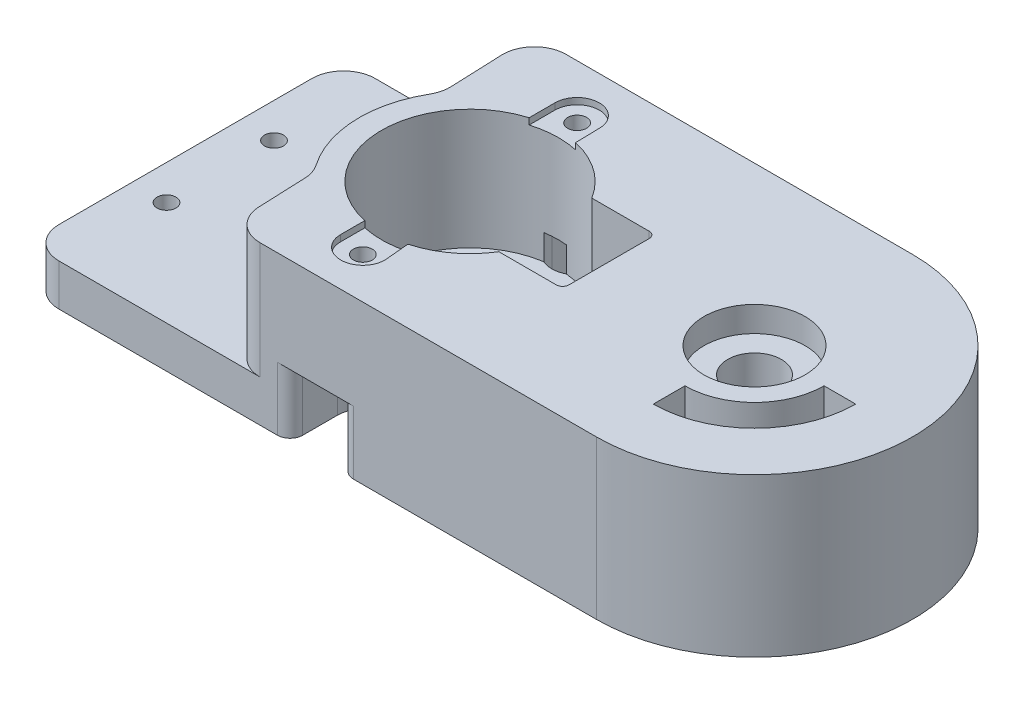
from build123d import *

# Parameters (mm, degrees)
BOSS_EXTRUDE1_DEPTH = 25
SKETCH2_R           = 14
CUT_EXTRUDE1_DEPTH  = 19
CUT_EXTRUDE2_DEPTH  = 1
SKETCH4_R           = 1.5
CUT_EXTRUDE3_DEPTH  = 79.108898341
SKETCH5_R           = 1.5
CUT_EXTRUDE4_DEPTH  = 79.108898341
CUT_EXTRUDE7_DEPTH  = 19
FILLET1_R           = 1
CUT_EXTRUDE8_DEPTH  = 18.4
FILLET2_R           = 5
SKETCH8_R           = 1.5
CUT_EXTRUDE9_DEPTH  = 77.573885888
SKETCH9_R           = 2.5
CUT_EXTRUDE10_DEPTH = 2
FILLET3_R           = 2
CUT_EXTRUDE11_DEPTH = 10
FILLET4_R           = 2
SKETCH11_R          = 8
CUT_EXTRUDE12_DEPTH = 4
SKETCH12_R          = 4.25
CUT_EXTRUDE13_DEPTH = 78.239886096
CUT_EXTRUDE16_DEPTH = 25


with BuildPart() as part:
    # Sketch1 → Boss-Extrude1 (new body)
    with BuildSketch(Plane(origin=(0, 0, 0), x_dir=(1, 0, 0), z_dir=(0, 1, 0))):
        with BuildLine():
            Line((-45, 25), (45, 25))
            ThreePointArc((45, 25), (70, 0), (45, -25))
            Line((45, -25), (-45, -25))
            Line((-45, -25), (-45, 25))
        make_face()
    extrude(amount=BOSS_EXTRUDE1_DEPTH)

    # Sketch2 → Cut-Extrude1 (cut)
    with BuildSketch(Plane(origin=(0, 25, 0), x_dir=(1, 0, 0), z_dir=(0, 1, 0))):
        with Locations(Location((0, 0, 0), (0, 0, 270))):
            Circle(SKETCH2_R)
    extrude(amount=-CUT_EXTRUDE1_DEPTH, mode=Mode.SUBTRACT)

    # Sketch3 → Cut-Extrude2 (cut)
    with BuildSketch(Plane(origin=(0, 25, 0), x_dir=(1, 0, 0), z_dir=(0, 1, 0))):
        with BuildLine():
            ThreePointArc((2.953843371, 17.491475436), (-0.546156629, 20.991475436), (-4.046156629, 17.491475436))
            Line((-4.046156629, 17.491475436), (-4.046156629, 13.402560074))
            ThreePointArc((-4.046156629, 13.402560074), (-0.522473122, 13.990247383), (3.035229041, 13.667018134))
            Line((3.035229041, 13.667018134), (2.953843371, 17.491475436))
        make_face()
        with BuildLine():
            Line((-2.953843371, -13.684838667), (-2.953843371, -17.491475436))
            ThreePointArc((-2.953843371, -17.491475436), (0.546156629, -20.991475436), (4.046156629, -17.491475436))
            Line((4.046156629, -17.491475436), (3.686093385, -13.506025158))
            ThreePointArc((3.686093385, -13.506025158), (0.376883388, -13.994926185), (-2.953843371, -13.684838667))
        make_face()
    extrude(amount=-CUT_EXTRUDE2_DEPTH, mode=Mode.SUBTRACT)

    # Sketch4 → Cut-Extrude3 (cut, through all)
    with BuildSketch(Plane(origin=(0, 24, 0), x_dir=(1, 0, 0), z_dir=(0, 1, 0))):
        with Locations(Location((-0.546156629, 17.491475436, 0), (0, 0, 270))):
            Circle(SKETCH4_R)
    extrude(amount=-CUT_EXTRUDE3_DEPTH, mode=Mode.SUBTRACT)

    # Sketch5 → Cut-Extrude4 (cut, through all)
    with BuildSketch(Plane(origin=(0, 24, 0), x_dir=(1, 0, 0), z_dir=(0, 1, 0))):
        with Locations(Location((0.546156629, -17.491475436, 0), (0, 0, 270))):
            Circle(SKETCH5_R)
    extrude(amount=-CUT_EXTRUDE4_DEPTH, mode=Mode.SUBTRACT)

    # Sketch6 → Cut-Extrude7 (cut)
    with BuildSketch(Plane(origin=(0, 25, 0), x_dir=(1, 0, 0), z_dir=(0, 1, 0))):
        with BuildLine():
            Line((22, 7.35), (22, -7.35))
            Line((22, -7.35), (11.915431171, -7.35))
            Line((11.915431171, -7.35), (11.920287143, -7.342121929))
            ThreePointArc((11.920287143, -7.342121929), (13.999999235, 0.004627215), (11.915431171, 7.35))
            Line((11.915431171, 7.35), (22, 7.35))
        make_face()
    extrude(amount=-CUT_EXTRUDE7_DEPTH, mode=Mode.SUBTRACT)

    # Fillet1
    fillet1_edges = [part.edges().sort_by_distance(p)[0] for p in [
        (22, 15.5, 7.35),
        (22, 15.5, -7.35),
    ]]
    fillet(fillet1_edges, radius=FILLET1_R)

    # Sketch7 → Cut-Extrude8 (cut)
    with BuildSketch(Plane(origin=(0, 25, 0), x_dir=(1, 0, 0), z_dir=(0, 1, 0))):
        with BuildLine():
            Line((-14.411704874, 9.927374408), (-15.019516237, 25))
            Line((-15.019516237, 25), (-45, 25))
            Line((-45, 25), (-45, -25))
            Line((-45, -25), (-13.003240573, -25))
            Line((-13.003240573, -25), (-13.565556796, -11.055571845))
            ThreePointArc((-13.565556796, -11.055571845), (-17.485788544, -0.705123398), (-14.411704874, 9.927374408))
        make_face()
    extrude(amount=-CUT_EXTRUDE8_DEPTH, mode=Mode.SUBTRACT)

    # Fillet2
    fillet2_edges = [part.edges().sort_by_distance(p)[0] for p in [
        (-45, 3.3, 25),
        (-45, 3.3, -25),
        (-14.411704874, 15.8, -9.927374408),
        (-13.565556796, 15.8, 11.055571845),
        (-13.003240573, 15.8, 25),
        (-15.019516237, 15.8, -25),
    ]]
    fillet(fillet2_edges, radius=FILLET2_R)

    # Sketch8 → Cut-Extrude9 (cut, through all)
    with BuildSketch(Plane(origin=(0, 6.6, 0), x_dir=(1, 0, 0), z_dir=(0, 1, 0))):
        with Locations(Location((-39.5, 8.5, 0), (0, 0, 270))):
            Circle(SKETCH8_R)
        with Locations(Location((-39.5, -8.5, 0), (0, 0, 270))):
            Circle(SKETCH8_R)
    extrude(amount=-CUT_EXTRUDE9_DEPTH, mode=Mode.SUBTRACT)

    # Sketch9 → Cut-Extrude10 (cut)
    with BuildSketch(Plane.XZ):
        with Locations(Location((-39.5, 8.5, 0), (0, 0, 270))):
            Circle(SKETCH9_R)
        with Locations(Location((-39.5, -8.5, 0), (0, 0, 270))):
            Circle(SKETCH9_R)
    extrude(amount=-CUT_EXTRUDE10_DEPTH, mode=Mode.SUBTRACT)

    # Fillet3
    fillet3_edges = [part.edges().sort_by_distance(p)[0] for p in [
        (-39.5, 0, 11),
        (-39.5, 0, -6),
    ]]
    fillet(fillet3_edges, radius=FILLET3_R - 0.0001)  # a hair under: the kernel refuses the full size

    # Sketch10 → Cut-Extrude11 (cut)
    with BuildSketch(Plane.XZ):
        with BuildLine():
            Line((-3.453843371, 17.491475436), (-3.453843371, 25))
            Line((-3.453843371, 25), (4.546156629, 25))
            Line((4.546156629, 25), (4.546156629, 17.491475436))
            ThreePointArc((4.546156629, 17.491475436), (0.546156629, 13.491475436), (-3.453843371, 17.491475436))
        make_face()
        with BuildLine():
            Line((-4.546156629, -17.491475436), (-4.546156629, -25))
            Line((-4.546156629, -25), (3.453843371, -25))
            Line((3.453843371, -25), (3.453843371, -17.491475436))
            ThreePointArc((3.453843371, -17.491475436), (-0.546156629, -13.491475436), (-4.546156629, -17.491475436))
        make_face()
    extrude(amount=-CUT_EXTRUDE11_DEPTH, mode=Mode.SUBTRACT)

    # Fillet4
    fillet4_edges = [part.edges().sort_by_distance(p)[0] for p in [
        (-3.453843371, 5, 25),
        (4.546156629, 5, 25),
        (3.453843371, 5, -25),
        (-4.546156629, 5, -25),
    ]]
    fillet(fillet4_edges, radius=FILLET4_R)

    # Sketch11 → Cut-Extrude12 (cut)
    with BuildSketch(Plane(origin=(0, 25, 0), x_dir=(1, 0, 0), z_dir=(0, 1, 0))):
        with Locations(Location((45, 0, 0), (0, 0, 270))):
            Circle(SKETCH11_R)
    extrude(amount=-CUT_EXTRUDE12_DEPTH, mode=Mode.SUBTRACT)

    # Sketch12 → Cut-Extrude13 (cut, through all)
    with BuildSketch(Plane(origin=(0, 21, 0), x_dir=(1, 0, 0), z_dir=(0, 1, 0))):
        with Locations(Location((45, 0, 0), (0, 0, 270))):
            Circle(SKETCH12_R)
    extrude(amount=-CUT_EXTRUDE13_DEPTH, mode=Mode.SUBTRACT)

    # Sketch19 → Cut-Extrude16 (cut)
    with BuildSketch(Plane.XZ):
        with BuildLine():
            Line((45, 11), (45, 16))
            ThreePointArc((45, 16), (56.313708499, 11.313708499), (61, 0))
            Line((61, 0), (56, 0))
            ThreePointArc((56, 0), (52.778174593, 7.778174593), (45, 11))
        make_face()
    extrude(amount=-CUT_EXTRUDE16_DEPTH, mode=Mode.SUBTRACT)


solid = part.part
